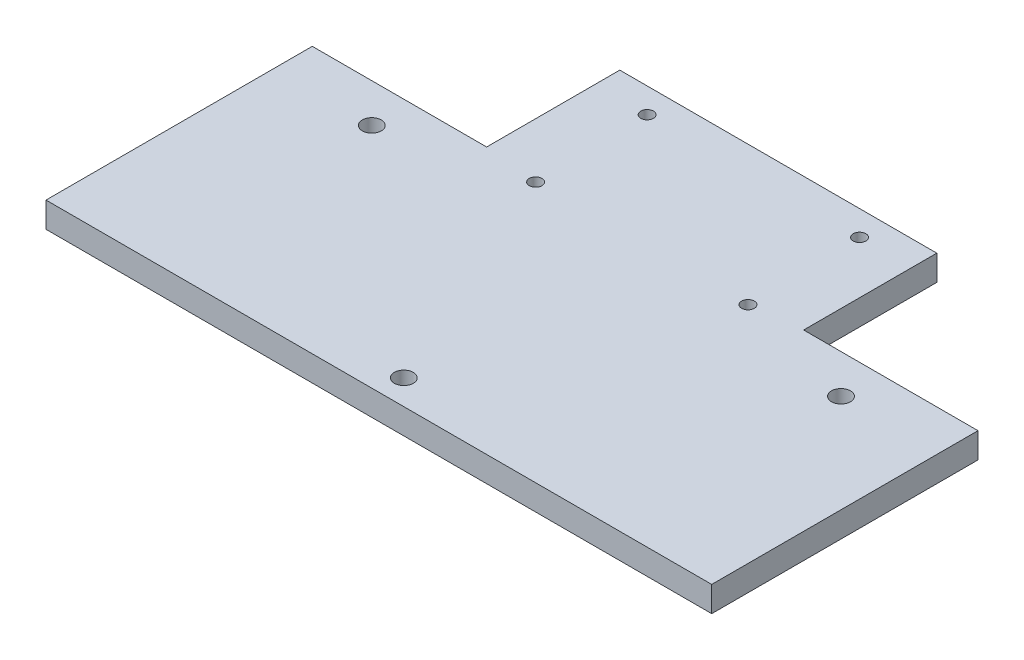
from build123d import *

# Parameters (mm, degrees)
SKETCH1_R           = 1.5
SKETCH1_R_2         = 1
BOSS_EXTRUDE1_DEPTH = 4


with BuildPart() as part:
    # Sketch1 → Boss-Extrude1 (new body)
    with BuildSketch(Plane(origin=(0, 0, 0), x_dir=(1, 0, 0), z_dir=(0, 1, 0))):
        Polygon((-47.617823434, 13.138325982), (-20.117823434, 13.138325982), (-20.117823434, 34.138325982), (29.882176566, 34.138325982), (29.882176566, 13.138325982), (57.382176566, 13.138325982), (57.382176566, -28.861674018), (-47.617823434, -28.861674018), align=None)
        with Locations((-32.117823434, 7.028381098)):
            Circle(SKETCH1_R, mode=Mode.SUBTRACT)
        with Locations((41.882176566, 7.028381098)):
            Circle(SKETCH1_R, mode=Mode.SUBTRACT)
        with Locations((4.882176566, -24.926770137)):
            Circle(SKETCH1_R, mode=Mode.SUBTRACT)
        with Locations((-11.867823434, 30.20271885)):
            Circle(SKETCH1_R_2, mode=Mode.SUBTRACT)
        with Locations((21.632176566, 30.20271885)):
            Circle(SKETCH1_R_2, mode=Mode.SUBTRACT)
        with Locations((-11.465097939, 12.207224631)):
            Circle(SKETCH1_R_2, mode=Mode.SUBTRACT)
        with Locations((22.034902061, 12.207224631)):
            Circle(SKETCH1_R_2, mode=Mode.SUBTRACT)
    extrude(amount=BOSS_EXTRUDE1_DEPTH)


solid = part.part
